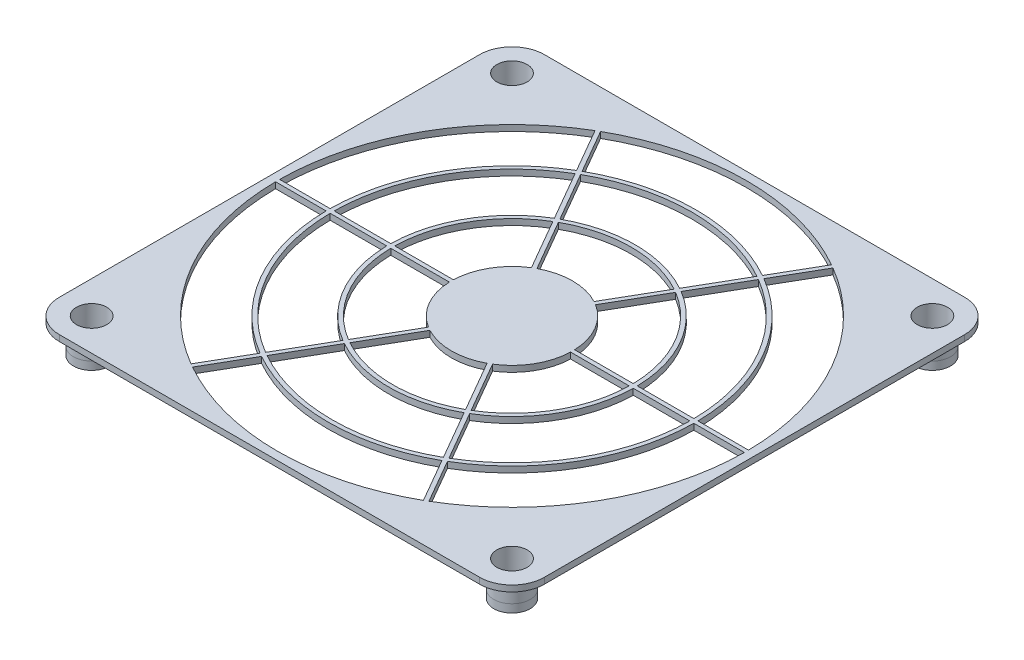
from build123d import *
from build123d.topology import SkipClean

# Parameters (mm, degrees)
SKETCH_1_R        = 3.75
SKETCH_1_R_2      = 58
EXTRUDE_1_DEPTH   = 1.5
EXTRUDE_START     = -1.5
EXTRUDE_1_2_DEPTH = 1.5
EXTRUDE_2_DEPTH   = 1.5
EXTRUDE_START_2   = 5
SKETCH_3_R        = 4.5
SKETCH_3_R_2      = 3.75
EXTRUDE_3_DEPTH   = 5
SKETCH_4_R        = 4.5
SKETCH_4_R_2      = 2.25
EXTRUDE_4_DEPTH   = 2
EXTRUDE_4_2_DEPTH = 2
EXTRUDE_4_3_DEPTH = 2
EXTRUDE_4_4_DEPTH = 2


# Read off the part's stored shape, not the designer's step: 拉伸-薄壁1
with BuildPart() as part:
    # 草图1 → Extrude 1 (new body)
    with BuildSketch(Plane(origin=(0, 0, 0), x_dir=(1, 0, 0), z_dir=(0, 1, 0))):
        with BuildLine():
            Line((-52, 60), (52, 60))
            ThreePointArc((52, 60), (57.656854249, 57.656854249), (60, 52))
            Line((60, 52), (60, -52))
            ThreePointArc((60, -52), (57.656854249, -57.656854249), (52, -60))
            Line((52, -60), (-52, -60))
            ThreePointArc((-52, -60), (-57.656854249, -57.656854249), (-60, -52))
            Line((-60, -52), (-60, 52))
            ThreePointArc((-60, 52), (-57.656854249, 57.656854249), (-52, 60))
        make_face()
        with Locations(Location((52, 52, 0), (0, 0, 270))):
            Circle(SKETCH_1_R, mode=Mode.SUBTRACT)
        with Locations(Location((52, -52, 0), (0, 0, 270))):
            Circle(SKETCH_1_R, mode=Mode.SUBTRACT)
        with Locations(Location((-52, 52, 0), (0, 0, 270))):
            Circle(SKETCH_1_R, mode=Mode.SUBTRACT)
        with Locations(Location((-52, -52, 0), (0, 0, 270))):
            Circle(SKETCH_1_R, mode=Mode.SUBTRACT)
        with Locations(Location((0, 0, 0), (0, 0, 270))):
            Circle(SKETCH_1_R_2, mode=Mode.SUBTRACT)
    extrude(amount=EXTRUDE_1_DEPTH)

    # Extrude 1 2 outline → Extrude 1 2 (add)
    with BuildSketch(Plane.XZ.offset(EXTRUDE_START)):
        with BuildLine():
            Line((57.997844907, 0.499986102), (45.497252664, 0.5))
            ThreePointArc((45.497252664, 0.5), (39.404155872, 22.75), (23.181639034, 39.15177661))
            Line((23.181639034, 39.15177661), (29.431923607, 49.977613716))
            ThreePointArc((29.431923607, 49.977613716), (28.999999948, 50.229473449), (28.565921191, 50.477600443))
            Line((28.565921191, 50.477600443), (22.31561363, 39.65177661))
            ThreePointArc((22.31561363, 39.65177661), (0, 45.5), (-22.31561363, 39.65177661))
            Line((-22.31561363, 39.65177661), (-28.565921191, 50.477600443))
            ThreePointArc((-28.565921191, 50.477600443), (-28.999999948, 50.229473449), (-29.431923607, 49.977613716))
            Line((-29.431923607, 49.977613716), (-23.181639034, 39.15177661))
            ThreePointArc((-23.181639034, 39.15177661), (-39.404155872, 22.75), (-45.497252664, 0.5))
            Line((-45.497252664, 0.5), (-57.997844907, 0.499986102))
            ThreePointArc((-57.997844907, 0.499986102), (-58, 0), (-57.997844907, -0.499986102))
            Line((-57.997844907, -0.499986102), (-45.497252664, -0.5))
            ThreePointArc((-45.497252664, -0.5), (-39.404155872, -22.75), (-23.181639034, -39.15177661))
            Line((-23.181639034, -39.15177661), (-29.431923607, -49.977613716))
            ThreePointArc((-29.431923607, -49.977613716), (-28.999999948, -50.229473449), (-28.565921191, -50.477600443))
            Line((-28.565921191, -50.477600443), (-22.31561363, -39.65177661))
            ThreePointArc((-22.31561363, -39.65177661), (0, -45.5), (22.31561363, -39.65177661))
            Line((22.31561363, -39.65177661), (28.565921191, -50.477600443))
            ThreePointArc((28.565921191, -50.477600443), (28.999999948, -50.229473449), (29.431923607, -49.977613716))
            Line((29.431923607, -49.977613716), (23.181639034, -39.15177661))
            ThreePointArc((23.181639034, -39.15177661), (39.404155872, -22.75), (45.497252664, -0.5))
            Line((45.497252664, -0.5), (57.997844907, -0.499986102))
            ThreePointArc((57.997844907, -0.499986102), (58, 0), (57.997844907, 0.499986102))
        make_face()
        with BuildLine():
            Line((-44.497190923, -0.5), (-30.495901364, -0.5))
            ThreePointArc((-30.495901364, -0.5), (-26.413774815, -15.25), (-15.680963384, -26.160225292))
            Line((-15.680963384, -26.160225292), (-22.681608163, -38.285697736))
            ThreePointArc((-22.681608163, -38.285697736), (-38.538130468, -22.25), (-44.497190923, -0.5))
        make_face(mode=Mode.SUBTRACT)
        with BuildLine():
            Line((-29.495762408, -0.5), (-0.866025404, -0.5))
            Line((-0.866025404, -0.5), (-15.180893906, -25.294079549))
            ThreePointArc((-15.180893906, -25.294079549), (-25.547749412, -14.75), (-29.495762408, -0.5))
        make_face(mode=Mode.SUBTRACT)
        with BuildLine():
            ThreePointArc((21.815582759, -38.785697736), (0, -44.5), (-21.815582759, -38.785697736))
            Line((-21.815582759, -38.785697736), (-14.81493798, -26.660225292))
            ThreePointArc((-14.81493798, -26.660225292), (0, -30.5), (14.81493798, -26.660225292))
            Line((14.81493798, -26.660225292), (21.815582759, -38.785697736))
        make_face(mode=Mode.SUBTRACT)
        with BuildLine():
            Line((-14.314868502, -25.794079549), (0, -1))
            Line((0, -1), (14.314868502, -25.794079549))
            ThreePointArc((14.314868502, -25.794079549), (0, -29.5), (-14.314868502, -25.794079549))
        make_face(mode=Mode.SUBTRACT)
        with BuildLine():
            Line((15.180893906, -25.294079549), (0.866025404, -0.5))
            Line((0.866025404, -0.5), (29.495762408, -0.5))
            ThreePointArc((29.495762408, -0.5), (25.547749412, -14.75), (15.180893906, -25.294079549))
        make_face(mode=Mode.SUBTRACT)
        with BuildLine():
            ThreePointArc((15.680963384, -26.160225292), (26.413774815, -15.25), (30.495901364, -0.5))
            Line((30.495901364, -0.5), (44.497190923, -0.5))
            ThreePointArc((44.497190923, -0.5), (38.538130468, -22.25), (22.681608163, -38.285697736))
            Line((22.681608163, -38.285697736), (15.680963384, -26.160225292))
        make_face(mode=Mode.SUBTRACT)
        with BuildLine():
            ThreePointArc((-15.680963384, 26.160225292), (-26.413774815, 15.25), (-30.495901364, 0.5))
            Line((-30.495901364, 0.5), (-44.497190923, 0.5))
            ThreePointArc((-44.497190923, 0.5), (-38.538130468, 22.25), (-22.681608163, 38.285697736))
            Line((-22.681608163, 38.285697736), (-15.680963384, 26.160225292))
        make_face(mode=Mode.SUBTRACT)
        with BuildLine():
            Line((-15.180893906, 25.294079549), (-0.866025404, 0.5))
            Line((-0.866025404, 0.5), (-29.495762408, 0.5))
            ThreePointArc((-29.495762408, 0.5), (-25.547749412, 14.75), (-15.180893906, 25.294079549))
        make_face(mode=Mode.SUBTRACT)
        with BuildLine():
            Line((29.495762408, 0.5), (0.866025404, 0.5))
            Line((0.866025404, 0.5), (15.180893906, 25.294079549))
            ThreePointArc((15.180893906, 25.294079549), (25.547749412, 14.75), (29.495762408, 0.5))
        make_face(mode=Mode.SUBTRACT)
        with BuildLine():
            Line((14.314868502, 25.794079549), (0, 1))
            Line((0, 1), (-14.314868502, 25.794079549))
            ThreePointArc((-14.314868502, 25.794079549), (0, 29.5), (14.314868502, 25.794079549))
        make_face(mode=Mode.SUBTRACT)
        with BuildLine():
            Line((44.497190923, 0.5), (30.495901364, 0.5))
            ThreePointArc((30.495901364, 0.5), (26.413774815, 15.25), (15.680963384, 26.160225292))
            Line((15.680963384, 26.160225292), (22.681608163, 38.285697736))
            ThreePointArc((22.681608163, 38.285697736), (38.538130468, 22.25), (44.497190923, 0.5))
        make_face(mode=Mode.SUBTRACT)
        with BuildLine():
            ThreePointArc((-21.815582759, 38.785697736), (0, 44.5), (21.815582759, 38.785697736))
            Line((21.815582759, 38.785697736), (14.81493798, 26.660225292))
            ThreePointArc((14.81493798, 26.660225292), (0, 30.5), (-14.81493798, 26.660225292))
            Line((-14.81493798, 26.660225292), (-21.815582759, 38.785697736))
        make_face(mode=Mode.SUBTRACT)
    extrude(amount=EXTRUDE_1_2_DEPTH)

    # 草图2<3> → 凸台-拉伸2 (add)
    with BuildSketch(Plane.XZ):
        with BuildLine():
            Line((-7.5, -12.990381057), (0, 0))
            Line((0, 0), (-15, 0))
            ThreePointArc((-15, 0), (-12.990381057, -7.5), (-7.5, -12.990381057))
        make_face()
        with BuildLine():
            Line((7.5, -12.990381057), (0, 0))
            Line((0, 0), (-7.5, -12.990381057))
            ThreePointArc((-7.5, -12.990381057), (0, -15), (7.5, -12.990381057))
        make_face()
        with BuildLine():
            Line((15, 0), (0, 0))
            Line((0, 0), (7.5, -12.990381057))
            ThreePointArc((7.5, -12.990381057), (12.990381057, -7.5), (15, 0))
        make_face()
        with BuildLine():
            Line((7.5, 12.990381057), (0, 0))
            Line((0, 0), (15, 0))
            ThreePointArc((15, 0), (12.990381057, 7.5), (7.5, 12.990381057))
        make_face()
        with BuildLine():
            Line((-7.5, 12.990381057), (0, 0))
            Line((0, 0), (7.5, 12.990381057))
            ThreePointArc((7.5, 12.990381057), (0, 15), (-7.5, 12.990381057))
        make_face()
        with BuildLine():
            Line((-15, 0), (0, 0))
            Line((0, 0), (-7.5, 12.990381057))
            ThreePointArc((-7.5, 12.990381057), (-12.990381057, 7.5), (-15, 0))
        make_face()
    extrude(amount=-EXTRUDE_2_DEPTH)

    # 草图3 → 凸台-拉伸3 (add)
    # profile 1 of 4: a face of its own
    with SkipClean():  # the faces are left unmerged after this step: merging them gives an invalid solid
        with BuildSketch(Plane.XZ.offset(EXTRUDE_START_2)):
            with Locations(Location((52, 52, 0), (0, 0, 270))):
                Circle(SKETCH_3_R)
            with Locations(Location((52, 52, 0), (0, 0, 270))):
                Circle(SKETCH_3_R_2, mode=Mode.SUBTRACT)
        # profile 2 of 4: a face of its own
        with BuildSketch(Plane.XZ.offset(EXTRUDE_START_2)):
            with Locations(Location((52, -52, 0), (0, 0, 90))):
                Circle(SKETCH_3_R)
            with Locations(Location((52, -52, 0), (0, 0, 90))):
                Circle(SKETCH_3_R_2, mode=Mode.SUBTRACT)
        # profile 3 of 4: a face of its own
        with BuildSketch(Plane.XZ.offset(EXTRUDE_START_2)):
            with Locations(Location((-52, -52, 0), (0, 0, 270))):
                Circle(SKETCH_3_R)
            with Locations(Location((-52, -52, 0), (0, 0, 270))):
                Circle(SKETCH_3_R_2, mode=Mode.SUBTRACT)
        # profile 4 of 4: a face of its own
        with BuildSketch(Plane.XZ.offset(EXTRUDE_START_2)):
            with Locations(Location((-52, 52, 0), (0, 0, 90))):
                Circle(SKETCH_3_R)
            with Locations(Location((-52, 52, 0), (0, 0, 90))):
                Circle(SKETCH_3_R_2, mode=Mode.SUBTRACT)
        extrude(amount=-EXTRUDE_3_DEPTH)


with BuildPart() as body_2:
    # 草图4 → 凸台-拉伸4 (new body)
    with BuildSketch(Plane.XZ.offset(5)):
        with Locations(Location((52, 52, 0), (0, 0, 270))):
            Circle(SKETCH_4_R)
        with Locations(Location((52, 52, 0), (0, 0, 270))):
            Circle(SKETCH_4_R_2, mode=Mode.SUBTRACT)
    extrude(amount=EXTRUDE_4_DEPTH)


with BuildPart() as body_3:
    # 草图4 → Extrude 4 2 (new body)
    with BuildSketch(Plane.XZ.offset(5)):
        with Locations(Location((52, -52, 0), (0, 0, 90))):
            Circle(SKETCH_4_R)
        with Locations(Location((52, -52, 0), (0, 0, 90))):
            Circle(SKETCH_4_R_2, mode=Mode.SUBTRACT)
    extrude(amount=EXTRUDE_4_2_DEPTH)


with BuildPart() as body_4:
    # 草图4 → Extrude 4 3 (new body)
    with BuildSketch(Plane.XZ.offset(5)):
        with Locations(Location((-52, -52, 0), (0, 0, 270))):
            Circle(SKETCH_4_R)
        with Locations(Location((-52, -52, 0), (0, 0, 270))):
            Circle(SKETCH_4_R_2, mode=Mode.SUBTRACT)
    extrude(amount=EXTRUDE_4_3_DEPTH)


with BuildPart() as body_5:
    # 草图4 → Extrude 4 4 (new body)
    with BuildSketch(Plane.XZ.offset(5)):
        with Locations(Location((-52, 52, 0), (0, 0, 90))):
            Circle(SKETCH_4_R)
        with Locations(Location((-52, 52, 0), (0, 0, 90))):
            Circle(SKETCH_4_R_2, mode=Mode.SUBTRACT)
    extrude(amount=EXTRUDE_4_4_DEPTH)


solid = Compound([part.part, body_2.part, body_3.part, body_4.part, body_5.part])
